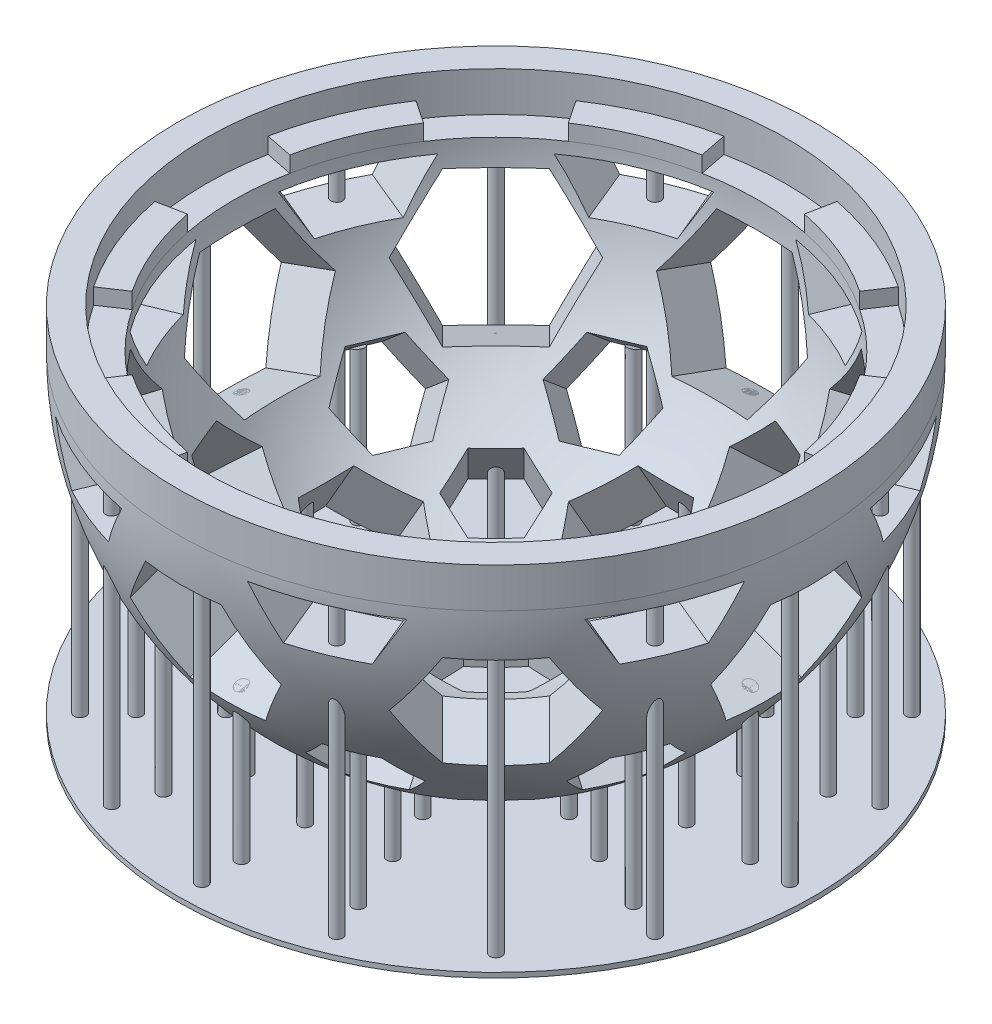
from build123d import *

# Parameters (mm, degrees)
CUT_EXTRUDE1_DEPTH      = 60
CIRPATTERN1_COUNT       = 8
CUT_EXTRUDE2_DEPTH      = 60
CIRPATTERN2_COUNT       = 8
CUT_EXTRUDE3_DEPTH      = 72
CIRPATTERN3_COUNT       = 8
CUT_EXTRUDE4_DEPTH      = 72
CUT_EXTRUDE5_DEPTH      = 72
CIRPATTERN4_COUNT       = 4
CUT_EXTRUDE6_REACH      = 70.927
CUT_EXTRUDE6_END_RADIUS = 40
CIRPATTERN5_COUNT       = 8
SKETCH14_R              = 40
BOSS_EXTRUDE1_DEPTH     = 0.617262
SKETCH15_R              = 0.75
BOSS_EXTRUDE8_DEPTH     = 38.8
CIRPATTERN6_COUNT       = 16
SKETCH16_R              = 0.75
BOSS_EXTRUDE13_DEPTH    = 23
CIRPATTERN10_COUNT      = 16
SKETCH17_R              = 0.75
BOSS_EXTRUDE16_DEPTH    = 12
CIRPATTERN11_COUNT      = 16
SKETCH18_R              = 0.75
BOSS_EXTRUDE17_DEPTH    = 2.5
CIRPATTERN12_COUNT      = 16
SKETCH19_R              = 0.75
BOSS_EXTRUDE19_DEPTH    = 5
CIRPATTERN13_COUNT      = 8
SKETCH20_R              = 2
CUT_EXTRUDE7_DEPTH      = 5
CIRPATTERN14_COUNT      = 16
SKETCH31_R              = 40
SKETCH31_R_2            = 33
BOSS_EXTRUDE41_DEPTH    = 5
SKETCH32_R              = 36.5
CUT_EXTRUDE8_DEPTH      = 3
CUT_EXTRUDE11_DEPTH     = 2
CIRPATTERN21_COUNT      = 8


with BuildPart() as part:
    # Sketch1 → Revolve1 (revolve)
    with BuildSketch(Plane.XY):
        with BuildLine():
            Line((0, -40), (0, -33))
            ThreePointArc((0, -33), (-23.334524, -23.334524), (-33, 0))
            Line((-33, 0), (-40, 0))
            ThreePointArc((-40, 0), (-28.284271, -28.284271), (0, -40))
        make_face()
    revolve(axis=Axis((0, -40, 0), (0, 1, 0)))

    # Sketch6 → Cut-Extrude1 (cut)
    with BuildSketch(Plane(origin=(0, 0, 0), x_dir=(1, 0, 0), z_dir=(0, -0.34202014332566943, 0.9396926207859081))):
        Polygon((4.75, -8.227241), (9.5, 0), (4.75, 8.227241), (-4.75, 8.227241), (-9.5, 0), (-4.75, -8.227241), align=None)
    cut_extrude1 = extrude(amount=CUT_EXTRUDE1_DEPTH, mode=Mode.SUBTRACT)

    # CirPattern1: Cut-Extrude1 ×8 about axis
    cirpattern1_axis = Axis((0, 0, 0), (0, 1, 0))
    for i in range(1, CIRPATTERN1_COUNT):
        add(cut_extrude1.rotate(cirpattern1_axis, i * 360 / CIRPATTERN1_COUNT), mode=Mode.SUBTRACT)

    # Sketch8 → Cut-Extrude2 (cut)
    with BuildSketch(Plane(origin=(0, 0, 0), x_dir=(0.3826834323650905, -2.170357963753732e-15, 0.9238795325112865), z_dir=(0.707732781991628, 0.6427876096865428, -0.29315251683697247))):
        Polygon((-2.886751, -5), (2.886751, -5), (5.773503, 0), (2.886751, 5), (-2.886751, 5), (-5.773503, 0), align=None)
    cut_extrude2 = extrude(amount=-CUT_EXTRUDE2_DEPTH, mode=Mode.SUBTRACT)

    # CirPattern2: Cut-Extrude2 ×8 about axis
    cirpattern2_axis = Axis((0, 0, 0), (0, 1, 0))
    for i in range(1, CIRPATTERN2_COUNT):
        add(cut_extrude2.rotate(cirpattern2_axis, i * 360 / CIRPATTERN2_COUNT), mode=Mode.SUBTRACT)

    # Sketch9 → Cut-Extrude3 (cut)
    with BuildSketch(Plane(origin=(0, 0, 0), x_dir=(1, 0, 0), z_dir=(0, -0.8660254037844398, 0.499999999999998))):
        Polygon((3.5, -6.062178), (7, 0), (3.5, 6.062178), (-3.5, 6.062178), (-7, 0), (-3.5, -6.062178), align=None)
    cut_extrude3 = extrude(amount=CUT_EXTRUDE3_DEPTH, mode=Mode.SUBTRACT)

    # CirPattern3: Cut-Extrude3 ×8 about axis, 4 skipped
    cirpattern3_axis = Axis((0, -40, 0), (0, 1, 0))
    add([cut_extrude3.rotate(cirpattern3_axis, i * 360 / CIRPATTERN3_COUNT) for i in range(1, CIRPATTERN3_COUNT) if i not in (1, 3, 5, 7)], mode=Mode.SUBTRACT)

    # Sketch10 → Cut-Extrude4 (cut)
    with BuildSketch(Plane(origin=(0, 0, 0), x_dir=(1, 0, 0), z_dir=(0, 1, 0))):
        Polygon((2.899495, -7), (7, -2.899495), (7, 2.899495), (2.899495, 7), (-2.899495, 7), (-7, 2.899495), (-7, -2.899495), (-2.899495, -7), align=None)
    extrude(amount=-CUT_EXTRUDE4_DEPTH, mode=Mode.SUBTRACT)

    # Sketch12 → Cut-Extrude5 (cut)
    with BuildSketch(Plane(origin=(0, 0, 0), x_dir=(-0.7071067811865464, -5.787092590307399e-15, 0.7071067811865488), z_dir=(0.37470950522067953, 0.8480480961564285, 0.3747095052206852))):
        Polygon((-5, 0), (-2.5, -4.330127), (2.5, -4.330127), (5, 0), (2.5, 4.330127), (-2.5, 4.330127), align=None)
    cut_extrude5 = extrude(amount=-CUT_EXTRUDE5_DEPTH, mode=Mode.SUBTRACT)

    # CirPattern4: Cut-Extrude5 ×4 about axis
    cirpattern4_axis = Axis((0, 0, 0), (0, 1, 0))
    for i in range(1, CIRPATTERN4_COUNT):
        add(cut_extrude5.rotate(cirpattern4_axis, i * 360 / CIRPATTERN4_COUNT), mode=Mode.SUBTRACT)

    # Cut-Extrude6: up to this sphere (the profile starts inside it)
    cut_extrude6_end = Location((0, 0, 0)) * Sphere(CUT_EXTRUDE6_END_RADIUS, mode=Mode.PRIVATE)
    # Sketch13 → Cut-Extrude6 (cut, up to the surface)
    with BuildSketch(Plane(origin=(0, 0, 0), x_dir=(0, 1, 0), z_dir=(0.3826834323650906, 1.3126994607605214e-15, 0.9238795325112865)), mode=Mode.PRIVATE) as cut_extrude6_sk1:
        Polygon((-1.5, 7.679715), (-1.5, -7.679715), (-7.400828, -4.27287), (-7.400828, 4.27287), align=None)
    cut_extrude6_tool1 = extrude(cut_extrude6_sk1.sketch, amount=-CUT_EXTRUDE6_REACH, mode=Mode.PRIVATE) & cut_extrude6_end
    cut_extrude6 = cut_extrude6_tool1.solids().sort_by_distance((0, -4.170095, 0))[0]
    add(cut_extrude6, mode=Mode.SUBTRACT)

    # CirPattern5: Cut-Extrude6 ×8 about axis
    cirpattern5_axis = Axis((0, 0, 0), (0, 1, 0))
    for i in range(1, CIRPATTERN5_COUNT):
        add(cut_extrude6.rotate(cirpattern5_axis, i * 360 / CIRPATTERN5_COUNT), mode=Mode.SUBTRACT)

    # Sketch31 → Boss-Extrude41 (add)
    with BuildSketch(Plane(origin=(0, 0, 0), x_dir=(1, 0, 0), z_dir=(0, 1, 0))):
        with Locations(Location((0, 0, 0), (0, 0, 270))):
            Circle(SKETCH31_R)
        Circle(SKETCH31_R_2, mode=Mode.SUBTRACT)
    extrude(amount=BOSS_EXTRUDE41_DEPTH)

    # Sketch32 → Cut-Extrude8 (cut)
    with BuildSketch(Plane(origin=(0, 5, 0), x_dir=(1, 0, 0), z_dir=(0, 1, 0))):
        with Locations(Location((0, 0, 0), (0, 0, 180))):
            Circle(SKETCH32_R)
    extrude(amount=-CUT_EXTRUDE8_DEPTH, mode=Mode.SUBTRACT)

    # Sketch37 → Cut-Extrude11 (cut)
    with BuildSketch(Plane(origin=(0, 2, 0), x_dir=(1, 0, 0), z_dir=(0, 1, 0))):
        with BuildLine():
            Line((-6.437981, 32.365914), (-7.120797, 35.798663))
            ThreePointArc((-7.120797, 35.798663), (0, 36.5), (7.120797, 35.798663))
            Line((7.120797, 35.798663), (6.437981, 32.365914))
            ThreePointArc((6.437981, 32.365914), (0, 33), (-6.437981, 32.365914))
        make_face()
    cut_extrude11 = extrude(amount=-CUT_EXTRUDE11_DEPTH, mode=Mode.SUBTRACT)

    # CirPattern21: Cut-Extrude11 ×8 about axis
    cirpattern21_axis = Axis((0, 0, 0), (0, 1, 0))
    for i in range(1, CIRPATTERN21_COUNT):
        add(cut_extrude11.rotate(cirpattern21_axis, i * 360 / CIRPATTERN21_COUNT), mode=Mode.SUBTRACT)


with BuildPart() as body_2:
    # Sketch14 → Boss-Extrude1 (new body)
    with BuildSketch(Plane(origin=(0, -40, 0), x_dir=(1, 0, 0), z_dir=(0, 1, 0))):
        with Locations(Location((0, 0, 0), (0, 0, 270))):
            Circle(SKETCH14_R)
    extrude(amount=BOSS_EXTRUDE1_DEPTH)

    # Sketch15 → Boss-Extrude8 (add)
    with BuildSketch(Plane(origin=(0, -39.382738, 0), x_dir=(1, 0, 0), z_dir=(0, 1, 0))):
        with Locations(Location((37, 0, 0), (0, 0, 270))):
            Circle(SKETCH15_R)
    boss_extrude8 = extrude(amount=BOSS_EXTRUDE8_DEPTH)

    # CirPattern6: Boss-Extrude8 ×16 about axis
    cirpattern6_axis = Axis((0, 0, 0), (0, 1, 0))
    for i in range(1, CIRPATTERN6_COUNT):
        add(boss_extrude8.rotate(cirpattern6_axis, i * 360 / CIRPATTERN6_COUNT))

    # Sketch16 → Boss-Extrude13 (add)
    with BuildSketch(Plane(origin=(0, -39.382738, 0), x_dir=(1, 0, 0), z_dir=(0, 1, 0))):
        with Locations(Location((-32, 0, 0), (0, 0, 270))):
            Circle(SKETCH16_R)
    boss_extrude13 = extrude(amount=BOSS_EXTRUDE13_DEPTH)

    # CirPattern10: Boss-Extrude13 ×16 about axis
    cirpattern10_axis = Axis((0, 0, 0), (0, 1, 0))
    for i in range(1, CIRPATTERN10_COUNT):
        add(boss_extrude13.rotate(cirpattern10_axis, i * 360 / CIRPATTERN10_COUNT))

    # Sketch17 → Boss-Extrude16 (add)
    with BuildSketch(Plane(origin=(0, -39.382738, 0), x_dir=(1, 0, 0), z_dir=(0, 1, 0))):
        with Locations(Location((0, 24, 0), (0, 0, 270))):
            Circle(SKETCH17_R)
    boss_extrude16 = extrude(amount=BOSS_EXTRUDE16_DEPTH)

    # CirPattern11: Boss-Extrude16 ×16 about axis
    cirpattern11_axis = Axis((0, 0, 0), (0, 1, 0))
    for i in range(1, CIRPATTERN11_COUNT):
        add(boss_extrude16.rotate(cirpattern11_axis, i * 360 / CIRPATTERN11_COUNT))

    # Sketch18 → Boss-Extrude17 (add)
    with BuildSketch(Plane(origin=(0, -39.382738, 0), x_dir=(1, 0, 0), z_dir=(0, 1, 0))):
        with Locations(Location((13, 0, 0), (0, 0, 270))):
            Circle(SKETCH18_R)
    boss_extrude17 = extrude(amount=BOSS_EXTRUDE17_DEPTH)

    # CirPattern12: Boss-Extrude17 ×16 about axis
    cirpattern12_axis = Axis((0, 0, 0), (0, 1, 0))
    for i in range(1, CIRPATTERN12_COUNT):
        add(boss_extrude17.rotate(cirpattern12_axis, i * 360 / CIRPATTERN12_COUNT))

    # Sketch19 → Boss-Extrude19 (add)
    with BuildSketch(Plane(origin=(0, -39.382738, 0), x_dir=(1, 0, 0), z_dir=(0, 1, 0))):
        with Locations(Location((15.705952, -6.505618, 0), (0, 0, 270))):
            Circle(SKETCH19_R)
    boss_extrude19 = extrude(amount=BOSS_EXTRUDE19_DEPTH)

    # CirPattern13: Boss-Extrude19 ×8 about axis
    cirpattern13_axis = Axis((0, 0, 0), (0, 1, 0))
    for i in range(1, CIRPATTERN13_COUNT):
        add(boss_extrude19.rotate(cirpattern13_axis, i * 360 / CIRPATTERN13_COUNT))

    # Sketch20 → Cut-Extrude7 (cut)
    with BuildSketch(Plane(origin=(-1.989715, -7.731078, -1.989715), x_dir=(0.9703149544244623, -0.23421234290964532, -0.06027825187435909), z_dir=(0.24184476264797208, 0.9396926207859089, 0.24184476264797644))):
        with Locations((24.989182, -27.118097)):
            Circle(SKETCH20_R)
    cut_extrude7 = extrude(amount=CUT_EXTRUDE7_DEPTH, mode=Mode.SUBTRACT)

    # CirPattern14: Cut-Extrude7 ×16 about axis
    cirpattern14_axis = Axis((0, 0, 0), (0, 1, 0))
    for i in range(1, CIRPATTERN14_COUNT):
        add(cut_extrude7.rotate(cirpattern14_axis, i * 360 / CIRPATTERN14_COUNT), mode=Mode.SUBTRACT)


solid = Compound([part.part, body_2.part])
